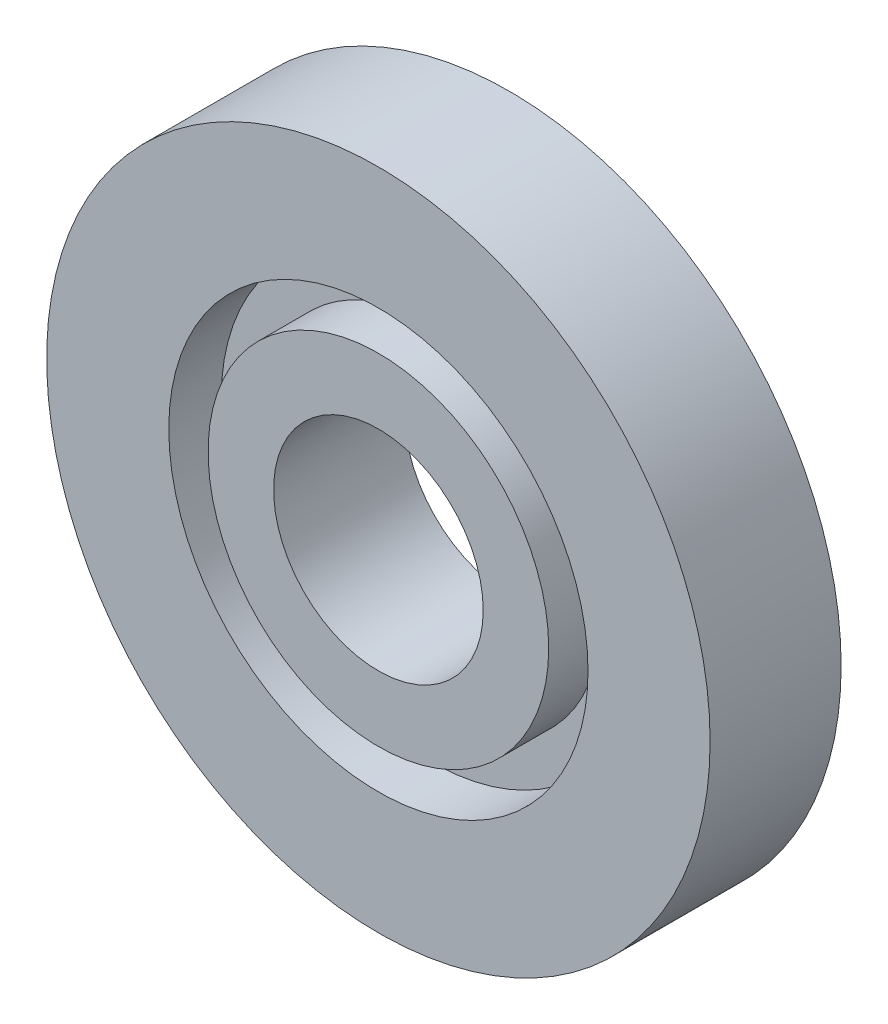
from build123d import *

# Parameters (mm, degrees)
CROQUIS1_R              = 6.33
SALIENTE_EXTRUIR2_DEPTH = 2.5
CROQUIS2_R              = 2
CORTAR_EXTRUIR1_DEPTH   = 5
CROQUIS3_R              = 4
CROQUIS3_R_2            = 3.25
CORTAR_EXTRUIR2_DEPTH   = 1
CORTAR_EXTRUIR3_START   = -1
CROQUIS4_R              = 4
CROQUIS4_R_2            = 3.25
CORTAR_EXTRUIR3_DEPTH   = 1


with BuildPart() as part:
    # Croquis1 → Saliente-Extruir2 (new body)
    with BuildSketch(Plane.XY):
        Circle(CROQUIS1_R)
    extrude(amount=SALIENTE_EXTRUIR2_DEPTH)

    # Croquis2 → Cortar-Extruir1 (cut)
    with BuildSketch(Plane.XY.offset(2.5)):
        Circle(CROQUIS2_R)
    extrude(amount=-CORTAR_EXTRUIR1_DEPTH, mode=Mode.SUBTRACT)

    # Croquis3 → Cortar-Extruir2 (cut)
    with BuildSketch(Plane.XY.offset(2.5)):
        Circle(CROQUIS3_R)
        Circle(CROQUIS3_R_2, mode=Mode.SUBTRACT)
    extrude(amount=-CORTAR_EXTRUIR2_DEPTH, mode=Mode.SUBTRACT)

    # Croquis4 → Cortar-Extruir3 (cut)
    with BuildSketch(Plane(origin=(0, 0, 0), x_dir=(-1, 0, 0), z_dir=(0, 0, -1)).offset(CORTAR_EXTRUIR3_START)):
        Circle(CROQUIS4_R)
        Circle(CROQUIS4_R_2, mode=Mode.SUBTRACT)
    extrude(amount=CORTAR_EXTRUIR3_DEPTH, mode=Mode.SUBTRACT)


solid = part.part
